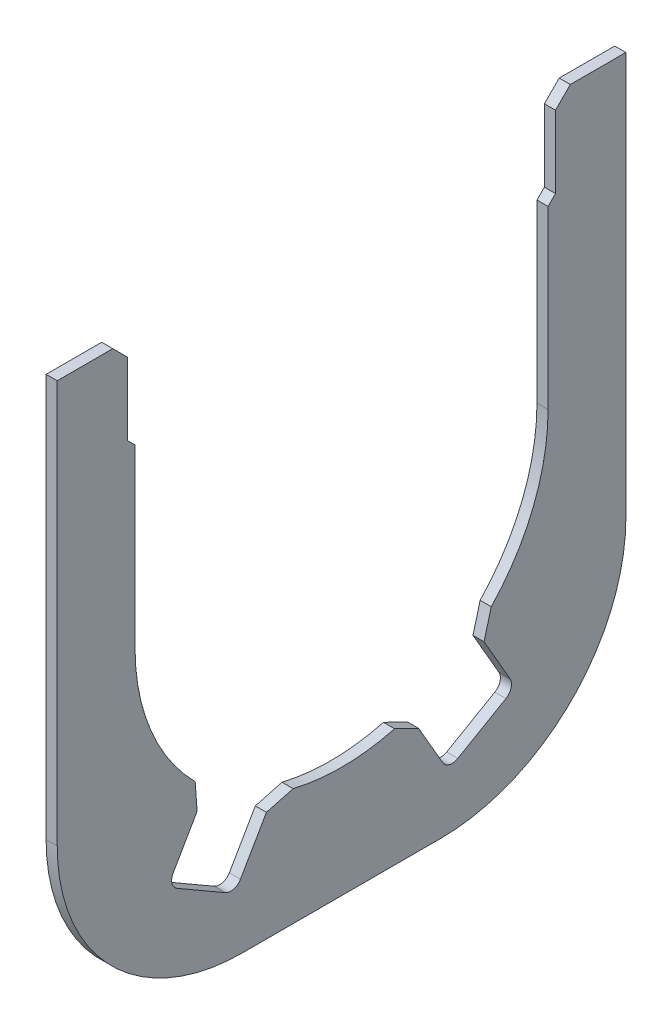
from build123d import *

# Parameters (mm, degrees)
SM_START                 = -3
SM_BASE_FLANGE_1_DEPTH   = 6
CUT_EXTRUDE_1_DEPTH      = 231.181450165
CUT_EXTRUDE_1_DEPTH_BACK = 231.181450165
SKETCH_7_W               = 4
SKETCH_7_H               = 47
CHAMFER_2_SIZE           = 8
CHAMFER_2_SIZE_2         = 10.078576046
FILLET_1_R               = 6
CHAMFER_3_SIZE           = 4


with BuildPart() as part:
    # Базовая кромка1: read off the stored shape, not the designer's step
    # Базовая кромка1 outline → Базовая кромка1 (new body)
    with BuildSketch(Plane(origin=(0, 0, 0), x_dir=(0, 0, -1), z_dir=(1, 0, 0)).offset(SM_START)):
        with BuildLine():
            Line((-111.5, 0), (-111.5, 146))
            Line((-111.5, 146), (-153.5, 146))
            Line((-153.5, 146), (-153.5, -71.5))
            ThreePointArc((-153.5, -71.5), (-124.210678119, -142.210678119), (-53.5, -171.5))
            Line((-53.5, -171.5), (53.5, -171.5))
            ThreePointArc((53.5, -171.5), (124.210678119, -142.210678119), (153.5, -71.5))
            Line((153.5, -71.5), (153.5, 146))
            Line((153.5, 146), (111.5, 146))
            Line((111.5, 146), (111.5, 0))
            ThreePointArc((111.5, 0), (0, -111.5), (-111.5, 0))
        make_face()
    extrude(amount=SM_BASE_FLANGE_1_DEPTH)

    # Эскиз7 → Вырез-Вытянуть1 (cut, two sides: drawn at the far end of the back side and taken through both)
    with BuildSketch(Plane(origin=(0, 0, 0), x_dir=(0, 0, -1), z_dir=(1, 0, 0)).offset(-CUT_EXTRUDE_1_DEPTH_BACK)):
        Polygon((72.938816537, -84.333736086), (36.565749578, -105.333736086), (57.565749578, -141.706803045), (93.938816537, -120.706803045), align=None)
        Polygon((-72.938816537, -84.333736086), (-93.938816537, -120.706803045), (-57.565749578, -141.706803045), (-36.565749578, -105.333736086), align=None)
        with Locations((-113.5, 122.5)):
            Rectangle(SKETCH_7_W, SKETCH_7_H)
        with Locations((113.5, 122.5)):
            Rectangle(SKETCH_7_W, SKETCH_7_H)
    extrude(amount=CUT_EXTRUDE_1_DEPTH + CUT_EXTRUDE_1_DEPTH_BACK, mode=Mode.SUBTRACT)

    # Фаска2
    # the kernel refuses this chamfer: 10.078576046, 8 mm, written as the material it takes off along each edge
    with BuildSketch(Plane(origin=(23.573463904, 146, -115.5), x_dir=(0, -1, 0), z_dir=(-1, 0, 0))) as chamfer_2_piece_1:
        Polygon((CHAMFER_2_SIZE, 0), (0, -CHAMFER_2_SIZE), (0, 0), align=None)
    extrude(amount=47.146927807, mode=Mode.SUBTRACT)
    with BuildSketch(Plane(origin=(-23.573463904, 146, 115.5), x_dir=(0, 0, 1), z_dir=(1, 0, 0))) as chamfer_2_piece_2:
        Polygon((CHAMFER_2_SIZE, 0), (0, CHAMFER_2_SIZE), (0, 0), align=None)
    extrude(amount=47.146927807, mode=Mode.SUBTRACT)
    with BuildSketch(Plane(origin=(31.048807118, -84.333736086, -72.938816537), x_dir=(0, -0.8660254037844384, -0.5000000000000006), z_dir=(-1, 0, 0)), Plane(origin=(31.048807118, -105.333736086, 36.565749578), x_dir=(0, -0.8660254037844385, 0.5000000000000004), z_dir=(-1, 0, 0))) as chamfer_2_piece_3:
        with BuildLine():
            Line((CHAMFER_2_SIZE, 0), (-2.56612789, -10.56612789))
            ThreePointArc((-2.56612789, -10.56612789), (-1.195031672, -5.481970258), (0, 0))
            Line((0, 0), (CHAMFER_2_SIZE, 0))
        make_face()
    extrude(amount=62.097614236, mode=Mode.SUBTRACT)
    with BuildSketch(Plane(origin=(-29.036718462, -105.333736086, -36.565749578), x_dir=(0, -0.2924871420802376, 0.9562694556022036), z_dir=(1, 0, 0))) as chamfer_2_piece_4:
        with BuildLine():
            Line((8.31589202, 0), (-CHAMFER_2_SIZE_2 * 0.224833432478, CHAMFER_2_SIZE_2 * 0.974397212447))
            Line((-CHAMFER_2_SIZE_2 * 0.224833432478, CHAMFER_2_SIZE_2 * 0.974397212447), (0, 0))
            ThreePointArc((0, 0), (4.305979523, 0.077455676), (8.31589202, 0))
        make_face()
    extrude(amount=58.073436924, mode=Mode.SUBTRACT)
    with BuildSketch(Plane(origin=(29.036718462, -84.333736086, 72.938816537), x_dir=(0, 0.6819100703745066, 0.7314360231228946), z_dir=(-1, 0, 0))) as chamfer_2_piece_5:
        with BuildLine():
            Line((8.31589202, 0), (-CHAMFER_2_SIZE_2 * 0.224833432478, -CHAMFER_2_SIZE_2 * 0.974397212447))
            Line((-CHAMFER_2_SIZE_2 * 0.224833432478, -CHAMFER_2_SIZE_2 * 0.974397212447), (0, 0))
            ThreePointArc((0, 0), (4.305979523, -0.077455676), (8.31589202, 0))
        make_face()
    extrude(amount=58.073436924, mode=Mode.SUBTRACT)

    # Скругление1
    fillet_1_edges = [part.edges().sort_by_distance(p)[0] for p in [
        (0, -120.706803045, -93.938816537),
        (0, -141.706803045, -57.565749578),
        (0, -141.706803045, 57.565749578),
        (0, -120.706803045, 93.938816537),
    ]]
    fillet(fillet_1_edges, radius=FILLET_1_R)

    # Фаска3
    chamfer_3_edges = [part.edges().sort_by_distance(p)[0] for p in [
        (0, 99, -111.5),
        (0, 99, 111.5),
    ]]
    chamfer(chamfer_3_edges, length=CHAMFER_3_SIZE - 0.0001)  # a hair under: the kernel refuses the full size


solid = part.part
